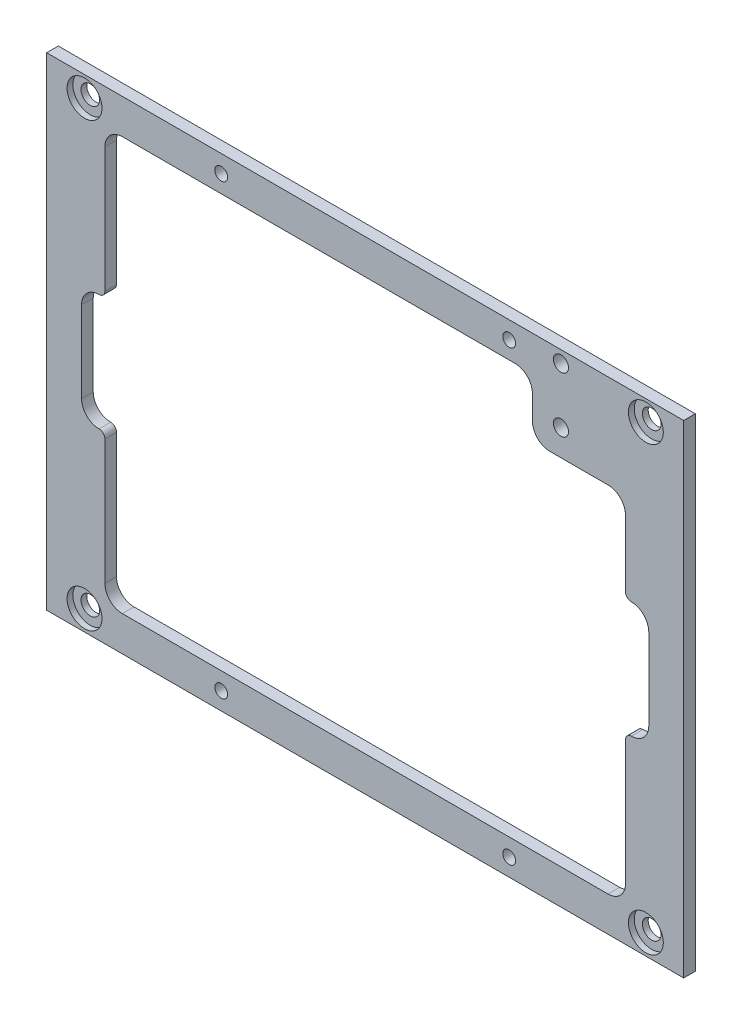
from build123d import *

# Parameters (mm, degrees)
SKETCH1_W                  = 109.5
SKETCH1_H                  = 83
BOSS_EXTRUDE1_DEPTH        = 2
F_3_2_3_2_DIAMETER_HOLE2_D = 3.2
F_2_6_2_6_DIAMETER_HOLE2_D = 2.6
F_2_6_2_6_DIAMETER_HOLE1_D = 2.6
SKETCH9_R                  = 3
CUT_EXTRUDE1_DEPTH         = 1
F_2_2_2_2_DIAMETER_HOLE1_D = 2.2
FILLET1_R                  = 1
FILLET2_R                  = 3


with BuildPart() as part:
    # Sketch1 → Boss-Extrude1 (new body)
    with BuildSketch(Plane.XY):
        with Locations((0, -41.5)):
            Rectangle(SKETCH1_W, SKETCH1_H)
        with BuildLine():
            Line((-44.75, -31.5), (-48.75, -31.5))
            Line((-48.75, -31.5), (-48.75, -51.5))
            Line((-48.75, -51.5), (-44.75, -51.5))
            Line((-44.75, -51.5), (-44.75, -74))
            ThreePointArc((-44.75, -74), (-43.871320344, -76.121320344), (-41.75, -77))
            Line((-41.75, -77), (41.75, -77))
            ThreePointArc((41.75, -77), (43.871320344, -76.121320344), (44.75, -74))
            Line((44.75, -74), (44.75, -51.5))
            Line((44.75, -51.5), (48.75, -51.5))
            Line((48.75, -51.5), (48.75, -41.5))
            Line((48.75, -41.5), (48.75, -31.5))
            Line((48.75, -31.5), (44.75, -31.5))
            Line((44.75, -31.5), (44.75, -19.1))
            ThreePointArc((44.75, -19.1), (43.871320344, -16.978679656), (41.75, -16.1))
            Line((41.75, -16.1), (31.75, -16.1))
            ThreePointArc((31.75, -16.1), (29.628679656, -15.221320344), (28.75, -13.1))
            Line((28.75, -13.1), (28.75, -9))
            ThreePointArc((28.75, -9), (27.871320344, -6.878679656), (25.75, -6))
            Line((25.75, -6), (-41.75, -6))
            ThreePointArc((-41.75, -6), (-43.871320344, -6.878679656), (-44.75, -9))
            Line((-44.75, -9), (-44.75, -31.5))
        make_face(mode=Mode.SUBTRACT)
    extrude(amount=BOSS_EXTRUDE1_DEPTH)

    # Ø3.2 (3.2) Diameter Hole2 (through all)
    with Locations(Plane.XY.offset(2)):
        with Locations((-48.25, -3.5), (-48.25, -79.5), (48.25, -79.5), (48.25, -3.5)):
            Hole(F_3_2_3_2_DIAMETER_HOLE2_D / 2)

    # Ø2.6 (2.6) Diameter Hole2 (through all)
    with Locations(Plane.XY.offset(2)):
        with Locations((33.65, -11.6)):
            Hole(F_2_6_2_6_DIAMETER_HOLE2_D / 2)

    # Ø2.6 (2.6) Diameter Hole1 (through all)
    with Locations(Plane.XY.offset(2)):
        with Locations((33.65, -2.07)):
            Hole(F_2_6_2_6_DIAMETER_HOLE1_D / 2)

    # Sketch9 → Cut-Extrude1 (cut)
    with BuildSketch(Plane.XY.offset(2)):
        with Locations((-48.25, -3.5)):
            Circle(SKETCH9_R)
        with Locations((48.25, -3.5)):
            Circle(SKETCH9_R)
        with Locations((48.25, -79.5)):
            Circle(SKETCH9_R)
        with Locations((-48.25, -79.5)):
            Circle(SKETCH9_R)
    extrude(amount=-CUT_EXTRUDE1_DEPTH, mode=Mode.SUBTRACT)

    # Ø2.2 (2.2) Diameter Hole1 (through all)
    with Locations(Plane.XY.offset(2)):
        with Locations((-24.75, -3), (24.75, -3), (-24.75, -80), (24.75, -80)):
            Hole(F_2_2_2_2_DIAMETER_HOLE1_D / 2)

    # Fillet1
    fillet1_edges = [part.edges().sort_by_distance(p)[0] for p in [
        (-44.75, -31.5, 1),
        (-44.75, -51.5, 1),
        (44.75, -51.5, 1),
        (44.75, -31.5, 1),
    ]]
    fillet(fillet1_edges, radius=FILLET1_R)

    # Fillet2
    fillet2_edges = [part.edges().sort_by_distance(p)[0] for p in [
        (48.75, -31.5, 1),
        (48.75, -51.5, 1),
        (-48.75, -51.5, 1),
        (-48.75, -31.5, 1),
    ]]
    fillet(fillet2_edges, radius=FILLET2_R - 0.0001)  # a hair under: the kernel refuses the full size


solid = part.part
